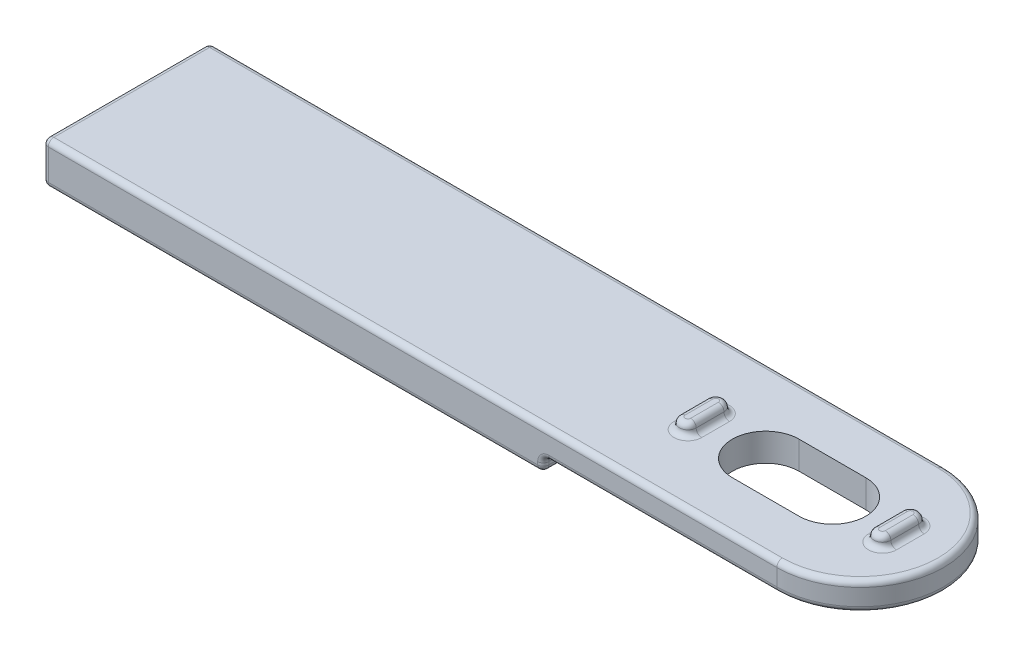
from build123d import *

# Parameters (mm, degrees)
SZKIC6_W                    = 147
SZKIC6_H                    = 30
DODANIE_WYCI_GNI_CIE2_DEPTH = 5
DODANIE_WYCI_GNI_CIE3_START = 2.5
SZKIC8_W                    = 147
SZKIC8_H                    = 30
DODANIE_WYCI_GNI_CIE3_DEPTH = 2.5
ZAOKR_GLENIE2_RADIUS        = 15
ZAOKR_GLENIE2_LENGTH        = 7.5
SZKIC9_W                    = 57
SZKIC9_H                    = 30
WYTNIJ_WYCI_GNI_CIE1_DEPTH  = 2.5
ZAOKR_GLENIE3_R             = 1
DODANIE_WYCI_GNI_CIE4_DEPTH = 2
ZAOKR_GLENIE4_R             = 1


with BuildPart() as part:
    # Szkic6 → Dodanie-wyciągnięcie2 (new body)
    with BuildSketch(Plane(origin=(0, 0, -30), x_dir=(-1, 0, 0), z_dir=(0, 1, 0))):
        with Locations((-73.5, 30)):
            Rectangle(SZKIC6_W, SZKIC6_H)
        with BuildLine():
            Line((-115, 36), (-127, 36))
            ThreePointArc((-127, 36), (-133, 30), (-127, 24))
            Line((-127, 24), (-115, 24))
            ThreePointArc((-115, 24), (-109, 30), (-115, 36))
        make_face(mode=Mode.SUBTRACT)
    extrude(amount=DODANIE_WYCI_GNI_CIE2_DEPTH)

    # Szkic8 → Dodanie-wyciągnięcie3 (add)
    with BuildSketch(Plane.XZ.offset(DODANIE_WYCI_GNI_CIE3_START)):
        with Locations((73.5, 0)):
            Rectangle(SZKIC8_W, SZKIC8_H)
        with BuildLine():
            Line((127, -6), (115, -6))
            ThreePointArc((115, -6), (109, 0), (115, 6))
            Line((115, 6), (127, 6))
            ThreePointArc((127, 6), (133, 0), (127, -6))
        make_face(mode=Mode.SUBTRACT)
    extrude(amount=-DODANIE_WYCI_GNI_CIE3_DEPTH)

    # Zaokrąglenie2: full round fillet: the end face becomes a half cylinder, R = half its width
    zaokr_glenie2_face = Plane((147, 1.25, 0), x_dir=(0, -1, 0), z_dir=(1, 0, 0))  # on the end face: x along it, z out of the body
    zaokr_glenie2_slab = zaokr_glenie2_face.offset(-ZAOKR_GLENIE2_RADIUS / 2) * Box(ZAOKR_GLENIE2_LENGTH, 2 * ZAOKR_GLENIE2_RADIUS, ZAOKR_GLENIE2_RADIUS, mode=Mode.PRIVATE)  # the body's end, R deep
    zaokr_glenie2_round = Plane((132, 1.25, 0), x_dir=(1, 0, 0), z_dir=(0, -1, 0)) * Cylinder(ZAOKR_GLENIE2_RADIUS, ZAOKR_GLENIE2_LENGTH, mode=Mode.PRIVATE)  # its axis R under the face
    add(zaokr_glenie2_slab - zaokr_glenie2_round, mode=Mode.SUBTRACT)

    # Szkic9 → Wytnij-wyciągnięcie1 (cut)
    with BuildSketch(Plane(origin=(0, -2.5, 0), x_dir=(1, 0, 0), z_dir=(0, 1, 0))):
        with Locations((118.5, 0)):
            Rectangle(SZKIC9_W, SZKIC9_H)
    extrude(amount=WYTNIJ_WYCI_GNI_CIE1_DEPTH, mode=Mode.SUBTRACT)

    # Zaokrąglenie3
    zaokr_glenie3_edges = [part.edges().sort_by_distance(p)[0] for p in [
        (0, 5, 0),
        (66, 5, 15),
        (0, -2.5, 0),
        (45, -2.5, -15),
        (66, 5, -15),
        (147, 5, 0),
        (45, -2.5, 15),
        (90, -2.5, 0),
        (90, -1.25, -15),
        (90, -1.25, 15),
        (111, 0, 15),
        (147, 0, 0),
        (111, 0, -15),
        (90, 0, 0),
        (0, 1.25, 15),
        (0, 1.25, -15),
    ]]
    fillet(zaokr_glenie3_edges, radius=ZAOKR_GLENIE3_R)

    # Szkic10 → Dodanie-wyciągnięcie4 (add)
    with BuildSketch(Plane(origin=(0, 5, 0), x_dir=(1, 0, 0), z_dir=(0, 1, 0))):
        with BuildLine():
            Line((102, -2.5), (102, 2.5))
            ThreePointArc((102, 2.5), (103.5, 4), (105, 2.5))
            Line((105, 2.5), (105, -2.5))
            ThreePointArc((105, -2.5), (103.5, -4), (102, -2.5))
        make_face()
        with BuildLine():
            Line((140, -2.5), (140, 2.5))
            ThreePointArc((140, 2.5), (138.5, 4), (137, 2.5))
            Line((137, 2.5), (137, -2.5))
            ThreePointArc((137, -2.5), (138.5, -4), (140, -2.5))
        make_face()
    extrude(amount=DODANIE_WYCI_GNI_CIE4_DEPTH)

    # Zaokrąglenie4
    zaokr_glenie4_edges = [part.edges().sort_by_distance(p)[0] for p in [
        (137, 7, 0),
        (138.5, 7, -4),
        (140, 7, 0),
        (137, 5, 0),
        (138.5, 5, -4),
        (140, 5, 0),
        (102, 7, 0),
        (103.5, 7, -4),
        (105, 7, 0),
        (102, 5, 0),
        (103.5, 5, -4),
        (105, 5, 0),
        (138.5, 7, 4),
        (138.5, 5, 4),
        (103.5, 7, 4),
        (103.5, 5, 4),
    ]]
    fillet(zaokr_glenie4_edges, radius=ZAOKR_GLENIE4_R - 0.0001)  # a hair under: the kernel refuses the full size


solid = part.part
